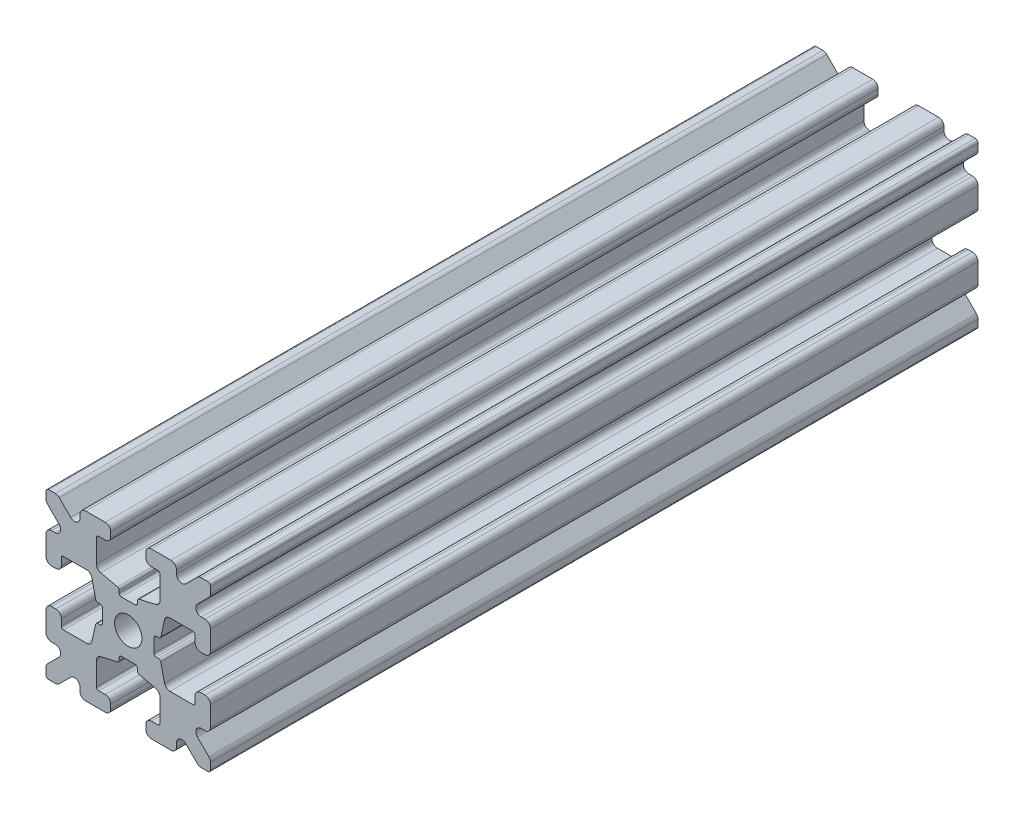
from build123d import *

# Parameters (mm, degrees)
SKETCH1_W           = 15
SKETCH1_H           = 15
SKETCH1_R           = 1.25
BOSS_EXTRUDE1_DEPTH = 35
FILLET1_R           = 0.25
CUT_EXTRUDE1_DEPTH  = 71.799011293
CUT_EXTRUDE3_DEPTH  = 71.799011293
FILLET3_R           = 0.5
FILLET4_R           = 0.5
FILLET5_R           = 3
FILLET6_R           = 0.2
CUT_EXTRUDE4_DEPTH  = 71.799011293
FILLET8_R           = 0.5
SKETCH6_W           = 5.1529354
SKETCH6_H           = 1.651
SKETCH6_W_2         = 1.651
SKETCH6_H_2         = 5.1529354
CUT_EXTRUDE5_DEPTH  = 71.799011293
FILLET10_R          = 0.2


with BuildPart() as part:
    # Sketch1 → Boss-Extrude1 (new, symmetric)
    with BuildSketch(Plane.XY):
        Rectangle(SKETCH1_W, SKETCH1_H)
        Circle(SKETCH1_R, mode=Mode.SUBTRACT)
    extrude(amount=BOSS_EXTRUDE1_DEPTH, both=True)

    # Fillet1
    fillet1_edges = [part.edges().sort_by_distance(p)[0] for p in [
        (7.5, -7.5, 0),
        (-7.5, -7.5, 0),
        (7.5, 7.5, 0),
        (-7.5, 7.5, 0),
    ]]
    fillet(fillet1_edges, radius=FILLET1_R)

    # Sketch2 → Cut-Extrude1 (cut, through all)
    with BuildSketch(Plane.XY.offset(35)):
        Polygon((-7.5, 1.6), (-6.1, 1.6), (-6.1, 2.9), (-3.4, 2.9), (-3.4, -2.9), (-6.1, -2.9), (-6.1, -1.6), (-7.5, -1.6), align=None)
        Polygon((2.9, 6.1), (1.6, 6.1), (1.6, 7.5), (-1.6, 7.5), (-1.6, 6.1), (-2.9, 6.1), (-2.9, 3.4), (2.9, 3.4), align=None)
        Polygon((-1.6, -7.5), (-1.6, -6.1), (-2.9, -6.1), (-2.9, -3.4), (2.9, -3.4), (2.9, -6.1), (1.6, -6.1), (1.6, -7.5), align=None)
        Polygon((6.1, -2.9), (6.1, -1.6), (7.5, -1.6), (7.5, 1.6), (6.1, 1.6), (6.1, 2.9), (3.4, 2.9), (3.4, -2.9), align=None)
    extrude(amount=-CUT_EXTRUDE1_DEPTH, mode=Mode.SUBTRACT)

    # Sketch4 → Cut-Extrude3 (cut, through all)
    with BuildSketch(Plane.XY.offset(35)):
        Polygon((-3.4, 2.9), (-2.75, 0), (-3.4, -2.9), align=None)
        Polygon((-2.9, 3.4), (0, 2.75), (2.9, 3.4), align=None)
        Polygon((3.4, 2.9), (2.75, 0), (3.4, -2.9), align=None)
        Polygon((-2.9, -3.4), (0, -2.75), (2.9, -3.4), align=None)
    extrude(amount=-CUT_EXTRUDE3_DEPTH, mode=Mode.SUBTRACT)

    # Fillet3
    fillet3_edges = [part.edges().sort_by_distance(p)[0] for p in [
        (-6.1, -1.6, 0),
        (-7.5, -1.6, 0),
        (-6.1, 1.6, 0),
        (-7.5, 1.6, 0),
        (-1.6, -7.5, 0),
        (-1.6, -6.1, 0),
        (1.6, -7.5, 0),
        (1.6, -6.1, 0),
        (6.1, -1.6, 0),
        (7.5, -1.6, 0),
        (7.5, 1.6, 0),
        (6.1, 1.6, 0),
        (1.6, 7.5, 0),
        (1.6, 6.1, 0),
        (-1.6, 7.5, 0),
        (-1.6, 6.1, 0),
    ]]
    fillet(fillet3_edges, radius=FILLET3_R)

    # Fillet4
    fillet4_edges = [part.edges().sort_by_distance(p)[0] for p in [
        (-3.4, 2.9, 0),
        (-3.4, -2.9, 0),
        (2.9, -3.4, 0),
        (-2.9, -3.4, 0),
        (3.4, -2.9, 0),
        (3.4, 2.9, 0),
        (-2.9, 3.4, 0),
        (2.9, 3.4, 0),
    ]]
    fillet(fillet4_edges, radius=FILLET4_R)

    # Fillet5
    fillet5_edges = [part.edges().sort_by_distance(p)[0] for p in [
        (0, -2.75, 0),
        (2.75, 0, 0),
        (-2.75, 0, 0),
        (0, 2.75, 0),
    ]]
    fillet(fillet5_edges, radius=FILLET5_R)

    # Fillet6
    fillet6_edges = [part.edges().sort_by_distance(p)[0] for p in [
        (-2.9, -6.1, 0),
        (2.9, -6.1, 0),
        (6.1, -2.9, 0),
        (6.1, 2.9, 0),
        (2.9, 6.1, 0),
        (-2.9, 6.1, 0),
        (-6.1, -2.9, 0),
        (-6.1, 2.9, 0),
    ]]
    fillet(fillet6_edges, radius=FILLET6_R)

    # Sketch5 → Cut-Extrude4 (cut, through all)
    with BuildSketch(Plane.XY.offset(35)):
        Polygon((-7.5, 6.439339828), (-5.460660172, 4.4), (-7.5, 4.4), align=None)
        Polygon((-6.439339828, 7.5), (-4.4, 5.460660172), (-4.4, 7.5), align=None)
        Polygon((4.4, 7.5), (6.439339828, 7.5), (4.4, 5.460660172), align=None)
        Polygon((7.5, 6.439339828), (7.5, 4.4), (5.460660172, 4.4), align=None)
        Polygon((7.5, -6.439339828), (5.460660172, -4.4), (7.5, -4.4), align=None)
        Polygon((6.439339828, -7.5), (4.4, -5.460660172), (4.4, -7.5), align=None)
        Polygon((-4.4, -7.5), (-6.439339828, -7.5), (-4.4, -5.460660172), align=None)
        Polygon((-7.5, -6.439339828), (-7.5, -4.4), (-5.460660172, -4.4), align=None)
    extrude(amount=-CUT_EXTRUDE4_DEPTH, mode=Mode.SUBTRACT)

    # Fillet8
    fillet8_edges = [part.edges().sort_by_distance(p)[0] for p in [
        (-5.460660172, 4.4, 0),
        (-7.5, 4.4, 0),
        (-5.460660172, -4.4, 0),
        (-7.5, -4.4, 0),
        (-4.4, -7.5, 0),
        (-4.4, -5.460660172, 0),
        (4.4, -7.5, 0),
        (4.4, -5.460660172, 0),
        (5.460660172, -4.4, 0),
        (7.5, -4.4, 0),
        (7.5, 4.4, 0),
        (5.460660172, 4.4, 0),
        (4.4, 5.460660172, 0),
        (4.4, 7.5, 0),
        (-4.4, 5.460660172, 0),
        (-4.4, 7.5, 0),
        (-6.439339828, 7.5, 0),
        (-7.5, 6.439339828, 0),
        (6.439339828, 7.5, 0),
        (7.5, 6.439339828, 0),
        (6.439339828, -7.5, 0),
        (7.5, -6.439339828, 0),
        (-6.439339828, -7.5, 0),
        (-7.5, -6.439339828, 0),
    ]]
    fillet(fillet8_edges, radius=FILLET8_R)

    # Sketch6 → Cut-Extrude5 (cut, through all)
    with BuildSketch(Plane.XY.offset(35)):
        with Locations((4.9235323, 0)):
            Rectangle(SKETCH6_W, SKETCH6_H)
        with Locations((0, -4.9235323)):
            Rectangle(SKETCH6_W_2, SKETCH6_H_2)
        with Locations((-4.9235323, 0)):
            Rectangle(SKETCH6_W, SKETCH6_H)
        with Locations((0, 4.9235323)):
            Rectangle(SKETCH6_W_2, SKETCH6_H_2)
    extrude(amount=-CUT_EXTRUDE5_DEPTH, mode=Mode.SUBTRACT)

    # Fillet10
    fillet10_edges = [part.edges().sort_by_distance(p)[0] for p in [
        (-2.935025862, 0.8255, 0),
        (-2.935025862, -0.8255, 0),
        (2.935025862, -0.8255, 0),
        (2.935025862, 0.8255, 0),
        (0.8255, 2.935025862, 0),
        (-0.8255, 2.935025862, 0),
        (-2.3470646, 0.8255, 0),
        (-2.3470646, -0.8255, 0),
        (0.8255, 2.3470646, 0),
        (-0.8255, 2.3470646, 0),
        (2.3470646, 0.8255, 0),
        (2.3470646, -0.8255, 0),
        (0.8255, -2.935025862, 0),
        (0.8255, -2.3470646, 0),
        (-0.8255, -2.3470646, 0),
        (-0.8255, -2.935025862, 0),
    ]]
    fillet(fillet10_edges, radius=FILLET10_R)


solid = part.part
